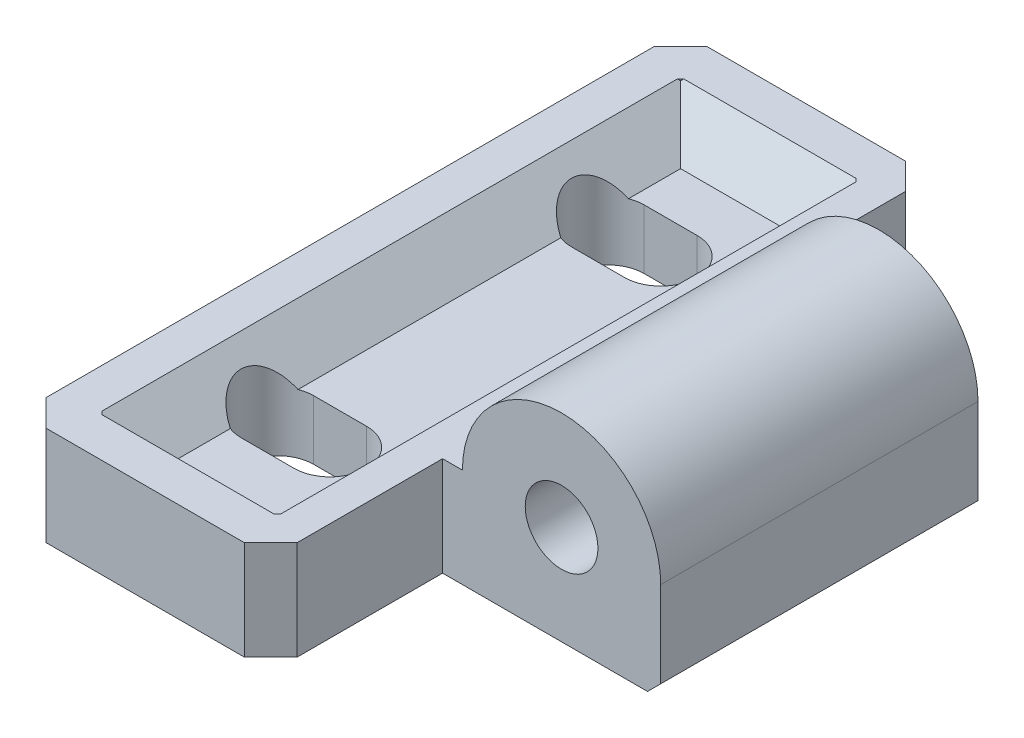
from build123d import *

# Parameters (mm, degrees)
BOSS_EXTRUDE1_DEPTH = 25
MOUNT_HOLES_DEPTH   = 41.422765863
SKETCH7_W           = 16.5
SKETCH7_H           = 13
CUT_PART_DEPTH      = 20
SKETCH10_R          = 2.75
CUT_EXTRUDE3_DEPTH  = 25
CHAMFER1_SIZE       = 2
CUT_EXTRUDE4_DEPTH  = 3
CHAMFER2_SIZE       = 3


with BuildPart() as part:
    # contour → Boss-Extrude1 (new, symmetric)
    with BuildSketch(Plane.XY):
        with BuildLine():
            Line((0, -7.5), (6.5, -7.5))
            Line((6.5, -7.5), (7.5, -6.5))
            Line((7.5, -6.5), (7.5, 0))
            ThreePointArc((7.5, 0), (-3.9135e-05, 7.5), (-7.5, -7.827e-05))
            Line((-7.5, -7.827e-05), (-28, -7.827e-05))
            Line((-28, -7.827e-05), (-28, -7.5))
            Line((-28, -7.5), (0, -7.5))
        make_face()
    extrude(amount=BOSS_EXTRUDE1_DEPTH, both=True)

    # Sketch6 → mount-holes (cut, through all)
    with BuildSketch(Plane.XZ.offset(7.5)):
        with BuildLine():
            Line((-21, 15.25), (-17, 15.25))
            ThreePointArc((-17, 15.25), (-14.25, 12.5), (-17, 9.75))
            Line((-17, 9.75), (-21, 9.75))
            ThreePointArc((-21, 9.75), (-23.75, 12.5), (-21, 15.25))
        make_face()
        with BuildLine():
            Line((-21, -9.75), (-17, -9.75))
            ThreePointArc((-17, -9.75), (-14.25, -12.5), (-17, -15.25))
            Line((-17, -15.25), (-21, -15.25))
            ThreePointArc((-21, -15.25), (-23.75, -12.5), (-21, -9.75))
        make_face()
    extrude(amount=-MOUNT_HOLES_DEPTH, mode=Mode.SUBTRACT)

    # Sketch7 → cut-part (cut)
    with BuildSketch(Plane.XZ.offset(7.5)):
        with Locations((-0.75, 18.5)):
            Rectangle(SKETCH7_W, SKETCH7_H)
        with Locations((-0.75, -18.5)):
            Rectangle(SKETCH7_W, SKETCH7_H)
    extrude(amount=-CUT_PART_DEPTH, mode=Mode.SUBTRACT)

    # Sketch10 → Cut-Extrude3 (cut, symmetric)
    with BuildSketch(Plane.XY):
        Circle(SKETCH10_R)
    extrude(amount=CUT_EXTRUDE3_DEPTH, both=True, mode=Mode.SUBTRACT)

    # Chamfer1
    chamfer1_edges = [part.edges().sort_by_distance(p)[0] for p in [
        (-28, -3.750039135, 25),
        (-9, -3.750039135, 25),
        (-28, -3.750039135, -25),
        (-9, -3.750039135, -25),
    ]]
    chamfer(chamfer1_edges, length=CHAMFER1_SIZE)

    # Sketch11 → Cut-Extrude4 (cut)
    with BuildSketch(Plane(origin=(0, -7.827e-05, 0), x_dir=(1, 0, 0), z_dir=(0, 1, 0))):
        Polygon((-11.5, -21.757359313), (-11.5, 21.757359313), (-11.742640687, 22), (-24.757359313, 22), (-25, 21.757359313), (-25, -21.757359313), (-24.757359313, -22), (-11.742640687, -22), align=None)
    extrude(amount=-CUT_EXTRUDE4_DEPTH, mode=Mode.SUBTRACT)

    # Chamfer2
    # the kernel refuses this chamfer: 3 mm, written as the material it adds along each edge
    with BuildSketch(Plane(origin=(-11.5, -3.00007827, 29.472408277), x_dir=(0.027495876610585626, 0.9996219169112968, 0), z_dir=(0, 0, -1))) as chamfer2_piece_1_section:
        Polygon((CHAMFER2_SIZE * 0.999621916911, -CHAMFER2_SIZE * 0.0274958766106), (-CHAMFER2_SIZE * 0.0274958766106, -CHAMFER2_SIZE * 0.999621916911), (0, 0), align=None)
    chamfer2_piece_1 = extrude(amount=58.944816554, mode=Mode.PRIVATE)
    chamfer2_piece_1 = split(chamfer2_piece_1, bisect_by=Plane(origin=(-12.500072931, -2.000114735, -22), z_dir=(0, 0, 1)), keep=Keep.TOP, mode=Mode.PRIVATE)
    chamfer2_piece_1 = split(chamfer2_piece_1, bisect_by=Plane(origin=(-1.121356809, -2.000114735, 11.378716122), z_dir=(-0.7071067811865476, 0, -0.7071067811865476)), keep=Keep.TOP, mode=Mode.PRIVATE)
    chamfer2_piece_1 = chamfer2_piece_1 - Plane(origin=(-17, -2.000114735, -12.5), x_dir=(0, 0, 1), z_dir=(0, -1, 0)) * Cylinder(2.75, 130, mode=Mode.PRIVATE)
    chamfer2_piece_1 = chamfer2_piece_1 - Plane(origin=(-17, -2.000114735, 12.5), x_dir=(0, 0, 1), z_dir=(0, -1, 0)) * Cylinder(2.75, 130, mode=Mode.PRIVATE)
    add(chamfer2_piece_1)
    with BuildSketch(Plane(origin=(-32.472408277, -3.00007827, 22), x_dir=(0, 0.9996219169112968, 0.027495876610586778), z_dir=(1, 0, 0))) as chamfer2_piece_2_section:
        Polygon((CHAMFER2_SIZE * 0.999621916911, -CHAMFER2_SIZE * 0.0274958766106), (-CHAMFER2_SIZE * 0.0274958766106, -CHAMFER2_SIZE * 0.999621916911), (0, 0), align=None)
    chamfer2_piece_2 = extrude(amount=28.444816553, mode=Mode.PRIVATE)
    chamfer2_piece_2 = split(chamfer2_piece_2, bisect_by=Plane(origin=(-11.5, -2.001383642, 20.997389255), z_dir=(-1, 0, 0)), keep=Keep.TOP, mode=Mode.PRIVATE)
    chamfer2_piece_2 = split(chamfer2_piece_2, bisect_by=Plane(origin=(-22.004985029, -2.001383642, 24.752374284), z_dir=(0.7071067811865527, 0, -0.7071067811865424)), keep=Keep.TOP, mode=Mode.PRIVATE)
    add(chamfer2_piece_2)
    with BuildSketch(Plane(origin=(-25, -3.00007827, -29.472408277), x_dir=(-0.027495876610586778, 0.9996219169112968, 0), z_dir=(0, 0, 1))) as chamfer2_piece_3_section:
        Polygon((CHAMFER2_SIZE * 0.999621916911, -CHAMFER2_SIZE * 0.0274958766106), (-CHAMFER2_SIZE * 0.0274958766106, -CHAMFER2_SIZE * 0.999621916911), (0, 0), align=None)
    chamfer2_piece_3 = extrude(amount=58.944816554, mode=Mode.PRIVATE)
    chamfer2_piece_3 = split(chamfer2_piece_3, bisect_by=Plane(origin=(-35.402787978, -1.975969948, -11.354571334), z_dir=(0.7071067811865527, 0, 0.7071067811865424)), keep=Keep.TOP, mode=Mode.PRIVATE)
    chamfer2_piece_3 = split(chamfer2_piece_3, bisect_by=Plane(origin=(-24.048216644, -1.975969948, 22), z_dir=(0, 0, -1)), keep=Keep.TOP, mode=Mode.PRIVATE)
    chamfer2_piece_3 = chamfer2_piece_3 - Plane(origin=(-21, -1.975969948, -12.5), x_dir=(0, 0, -1), z_dir=(0, -1, 0)) * Cylinder(2.75, 130, mode=Mode.PRIVATE)
    chamfer2_piece_3 = chamfer2_piece_3 - Plane(origin=(-21, -1.975969948, 12.5), x_dir=(0, 0, -1), z_dir=(0, -1, 0)) * Cylinder(2.75, 130, mode=Mode.PRIVATE)
    add(chamfer2_piece_3)
    with BuildSketch(Plane(origin=(-4.027591723, -3.00007827, -22), x_dir=(0, 0.9996219169112968, -0.027495876610586778), z_dir=(-1, 0, 0))) as chamfer2_piece_4_section:
        Polygon((CHAMFER2_SIZE * 0.999621916911, -CHAMFER2_SIZE * 0.0274958766106), (-CHAMFER2_SIZE * 0.0274958766106, -CHAMFER2_SIZE * 0.999621916911), (0, 0), align=None)
    chamfer2_piece_4 = extrude(amount=28.444816553, mode=Mode.PRIVATE)
    chamfer2_piece_4 = split(chamfer2_piece_4, bisect_by=Plane(origin=(-11.5, -2.001383642, -20.997389255), z_dir=(-1, 0, 0)), keep=Keep.TOP, mode=Mode.PRIVATE)
    chamfer2_piece_4 = split(chamfer2_piece_4, bisect_by=Plane(origin=(-25, -2.001383642, -20.997389255), z_dir=(1, 0, 0)), keep=Keep.TOP, mode=Mode.PRIVATE)
    add(chamfer2_piece_4)


solid = part.part
